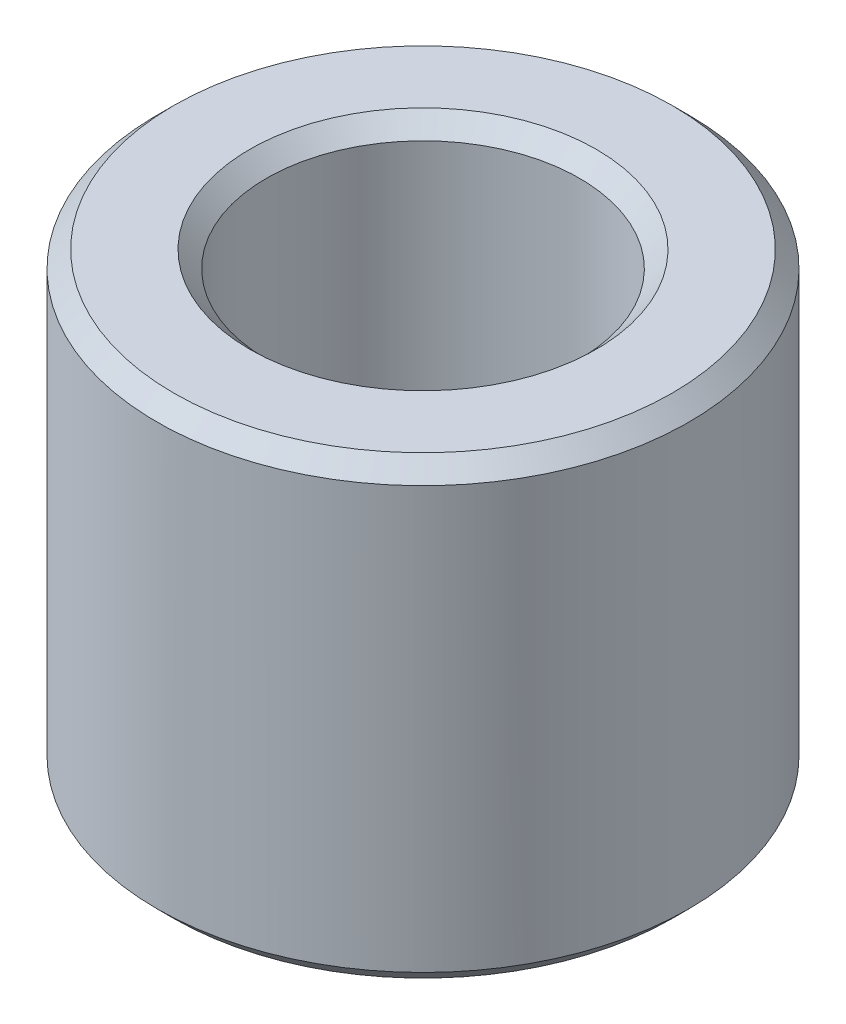
from build123d import *

# Parameters (mm, degrees)
SKETCH1_R           = 7.5
BOSS_EXTRUDE1_DEPTH = 12.834242233
SKETCH2_R           = 4.415631687
CUT_EXTRUDE1_DEPTH  = 17.649858068
CHAMFER1_SIZE       = 0.471792199


with BuildPart() as part:
    # Sketch1 → Boss-Extrude1 (new body)
    with BuildSketch(Plane(origin=(0, 0, 0), x_dir=(1, 0, 0), z_dir=(0, 1, 0))):
        Circle(SKETCH1_R)
    extrude(amount=BOSS_EXTRUDE1_DEPTH)

    # Sketch2 → Cut-Extrude1 (cut, through all)
    with BuildSketch(Plane(origin=(0, 0, 0), x_dir=(1, 0, 0), z_dir=(0, 1, 0))):
        Circle(SKETCH2_R)
    extrude(amount=CUT_EXTRUDE1_DEPTH, mode=Mode.SUBTRACT)

    # Chamfer1
    chamfer1_edges = [part.edges().sort_by_distance(p)[0] for p in [
        (-4.415631687, 12.834242233, 0),
        (-4.415631687, 0, 0),
        (-7.5, 0, 0),
        (-7.5, 12.834242233, 0),
    ]]
    chamfer(chamfer1_edges, length=CHAMFER1_SIZE)


solid = part.part
